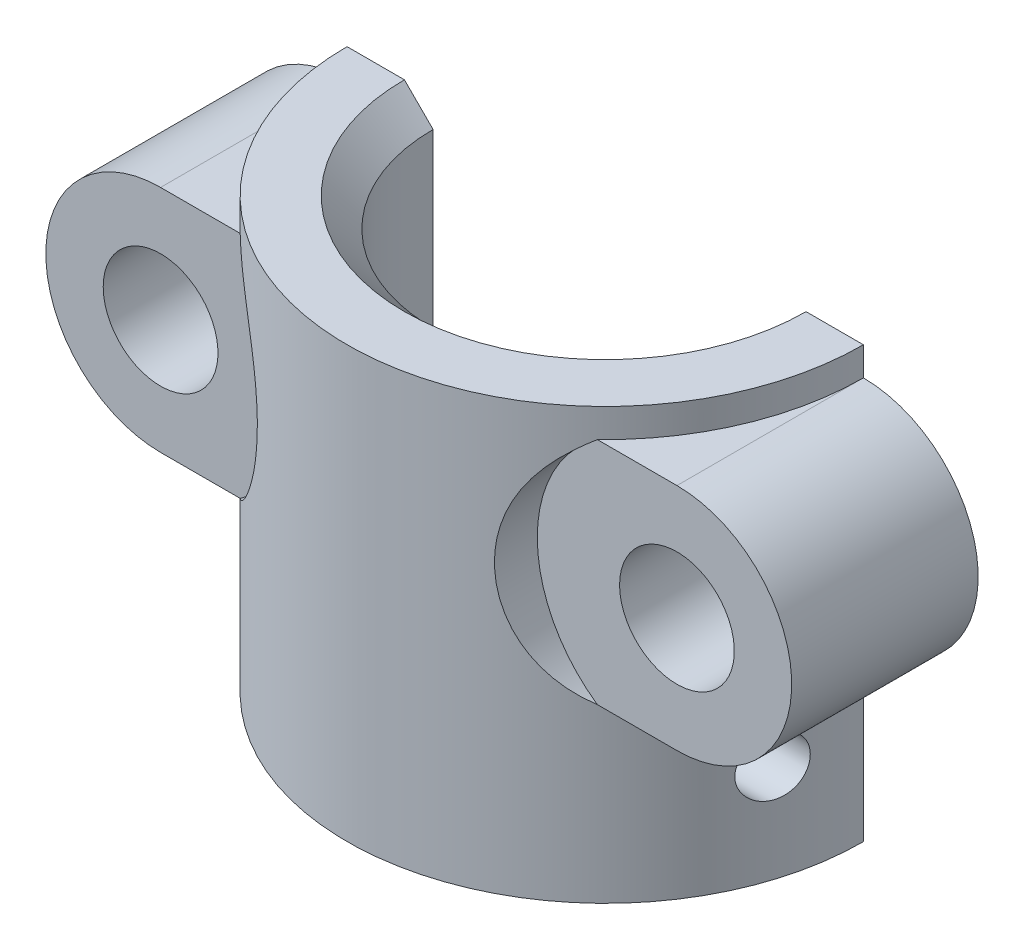
from build123d import *

# Parameters (mm, degrees)
CROQUIS2_R                 = 2
SALIENTE_EXTRUIR1_DEPTH    = 6.5
SALIENTE_EXTRUIR1_2_DEPTH  = 6.5
SALIENTE_EXTRUIR2_DEPTH    = 15
CORTAR_EXTRUIR3_START      = -7
CROQUIS7_R                 = 2
CORTAR_EXTRUIR3_DEPTH      = 7
CORTAR_EXTRUIR5_START      = -7.364158067
CORTAR_EXTRUIR5_DEPTH      = 6
CORTAR_EXTRUIR5_START_2    = 6.635841933
CORTAR_EXTRUIR5_2_DEPTH    = 1
CROQUIS13_R                = 4.868357384
CORTAR_EXTRUIR6_DEPTH      = 4
CHAFL_N1_SIZE              = 1
CORTAR_EXTRUIR7_REACH      = 26.966
CORTAR_EXTRUIR7_END_RADIUS = 6
CROQUIS14_R                = 1


# Read off the part's stored shape, not the designer's step: Cortar-Extruir5
with BuildPart() as part:
    # Croquis2 → Saliente-Extruir1 (new body)
    with BuildSketch(Plane.XY):
        with BuildLine():
            ThreePointArc((-8.933187638, -1.364158067), (-12.933187638, 2.635841933), (-8.933187638, 6.635841933))
            Line((-8.933187638, 6.635841933), (-8.933187638, 7.635841933))
            Line((-8.933187638, 7.635841933), (-5.933187638, 7.635841933))
            Line((-5.933187638, 7.635841933), (-5.933187638, -7.364158067))
            Line((-5.933187638, -7.364158067), (-8.933187638, -7.364158067))
            Line((-8.933187638, -7.364158067), (-8.933187638, -1.364158067))
        make_face()
        with Locations(Location((-8.933187638, 2.635841933, 0), (0, 0, 180))):
            Circle(CROQUIS2_R, mode=Mode.SUBTRACT)
    extrude(amount=SALIENTE_EXTRUIR1_DEPTH)



with BuildPart() as body_2:
    # Croquis2 → Saliente-Extruir1 2 (new body)
    with BuildSketch(Plane.XY):
        with BuildLine():
            Line((9.066812362, -1.364158067), (9.066812362, -7.364158067))
            Line((9.066812362, -7.364158067), (6.066812362, -7.364158067))
            Line((6.066812362, -7.364158067), (6.066812362, 7.635841933))
            Line((6.066812362, 7.635841933), (9.066812362, 7.635841933))
            Line((9.066812362, 7.635841933), (9.066812362, 6.635841933))
            ThreePointArc((9.066812362, 6.635841933), (13.066812362, 2.635841933), (9.066812362, -1.364158067))
        make_face()
        with Locations(Location((9.066812362, 2.635841933, 0), (0, 0, 180))):
            Circle(CROQUIS2_R, mode=Mode.SUBTRACT)
    extrude(amount=SALIENTE_EXTRUIR1_2_DEPTH)


with BuildPart() as part_1:
    add(part.part)

    add(body_2.part)  # Saliente-Extruir2 merges body 2
    # Croquis3 → Saliente-Extruir2 (add, through all)
    with BuildSketch(Plane.XZ.offset(7.364158067)):
        with BuildLine():
            Line((-8.933187638, 0), (-5.933187638, 0))
            ThreePointArc((-5.933187638, 0), (0.066812362, 6), (6.066812362, 0))
            Line((6.066812362, 0), (9.066812362, 0))
            ThreePointArc((9.066812362, 0), (0.066812362, 9), (-8.933187638, 0))
        make_face()
    extrude(amount=-SALIENTE_EXTRUIR2_DEPTH)

    # Croquis7 → Cortar-Extruir3 (cut)
    with BuildSketch(Plane.XY.offset(6.5).offset(CORTAR_EXTRUIR3_START)):
        with Locations(Location((9.066812362, 2.635841933, 0), (0, 0, 180))):
            Circle(CROQUIS7_R)
        with Locations(Location((-8.933187638, 2.635841933, 0), (0, 0, 180))):
            Circle(CROQUIS7_R)
    extrude(amount=CORTAR_EXTRUIR3_DEPTH, mode=Mode.SUBTRACT)

    # Cortar-Extruir5 outline → Cortar-Extruir5 (cut)
    with BuildSketch(Plane(origin=(0, 0, 0), x_dir=(1, 0, 0), z_dir=(0, 1, 0)).offset(CORTAR_EXTRUIR5_START)):
        with BuildLine():
            Line((9.066812362, -6.5), (9.066812362, 0))
            ThreePointArc((9.066812362, 0), (8.344026513, -3.53379766), (6.291762161, -6.5))
            Line((6.291762161, -6.5), (9.066812362, -6.5))
        make_face()
        with BuildLine():
            Line((-8.933187638, -6.5), (-6.158137437, -6.5))
            ThreePointArc((-6.158137437, -6.5), (-8.210401789, -3.53379766), (-8.933187638, 0))
            Line((-8.933187638, 0), (-8.933187638, -6.5))
        make_face()
    extrude(amount=CORTAR_EXTRUIR5_DEPTH, mode=Mode.SUBTRACT)

    # Cortar-Extruir5 2 outline → Cortar-Extruir5 2 (cut)
    with BuildSketch(Plane(origin=(0, 0, 0), x_dir=(1, 0, 0), z_dir=(0, 1, 0)).offset(CORTAR_EXTRUIR5_START_2)):
        with BuildLine():
            Line((9.066812362, -6.5), (9.066812362, 0))
            ThreePointArc((9.066812362, 0), (8.344026513, -3.53379766), (6.291762161, -6.5))
            Line((6.291762161, -6.5), (9.066812362, -6.5))
        make_face()
        with BuildLine():
            Line((-8.933187638, -6.5), (-6.158137437, -6.5))
            ThreePointArc((-6.158137437, -6.5), (-8.210401789, -3.53379766), (-8.933187638, 0))
            Line((-8.933187638, 0), (-8.933187638, -6.5))
        make_face()
    extrude(amount=CORTAR_EXTRUIR5_2_DEPTH, mode=Mode.SUBTRACT)

    # Croquis13 → Cortar-Extruir6 (cut)
    with BuildSketch(Plane.XY.offset(6.5)):
        with Locations((9.066812362, 2.635841933)):
            Circle(CROQUIS13_R)
        with Locations((-8.933187638, 2.635841933)):
            Circle(CROQUIS13_R)
    extrude(amount=CORTAR_EXTRUIR6_DEPTH, mode=Mode.SUBTRACT)

    # Chaflán1
    chafl_n1_edges = [part_1.edges().sort_by_distance(p)[0] for p in [
        (0.066812362, 7.635841933, 6),
        (0.066812362, -7.364158067, 6),
    ]]
    chamfer(chafl_n1_edges, length=CHAFL_N1_SIZE)

    # Cortar-Extruir7: up to this cylinder (the profile starts outside it)
    cortar_extruir7_end = Plane(origin=(0.066812362, -3.95674, 0), z_dir=(0, -1, 0)) * Cylinder(CORTAR_EXTRUIR7_END_RADIUS, 66.932, mode=Mode.PRIVATE)
    # Croquis14 → Cortar-Extruir7 (cut, up to the surface)
    with BuildSketch(Plane(origin=(9.066812362, 0, 0), x_dir=(0, -1, 0), z_dir=(-1, 0, 0)), mode=Mode.PRIVATE) as cortar_extruir7_sk1:
        with Locations(Location((3.956739881, 2.692300291, 0), (0, 0, 270))):
            Circle(CROQUIS14_R)
    cortar_extruir7_tool1 = extrude(cortar_extruir7_sk1.sketch, amount=CORTAR_EXTRUIR7_REACH, mode=Mode.PRIVATE) - cortar_extruir7_end
    add(cortar_extruir7_tool1.solids().sort_by_distance((9.066812, -3.95674, 2.6923))[0], mode=Mode.SUBTRACT)


solid = part_1.part
